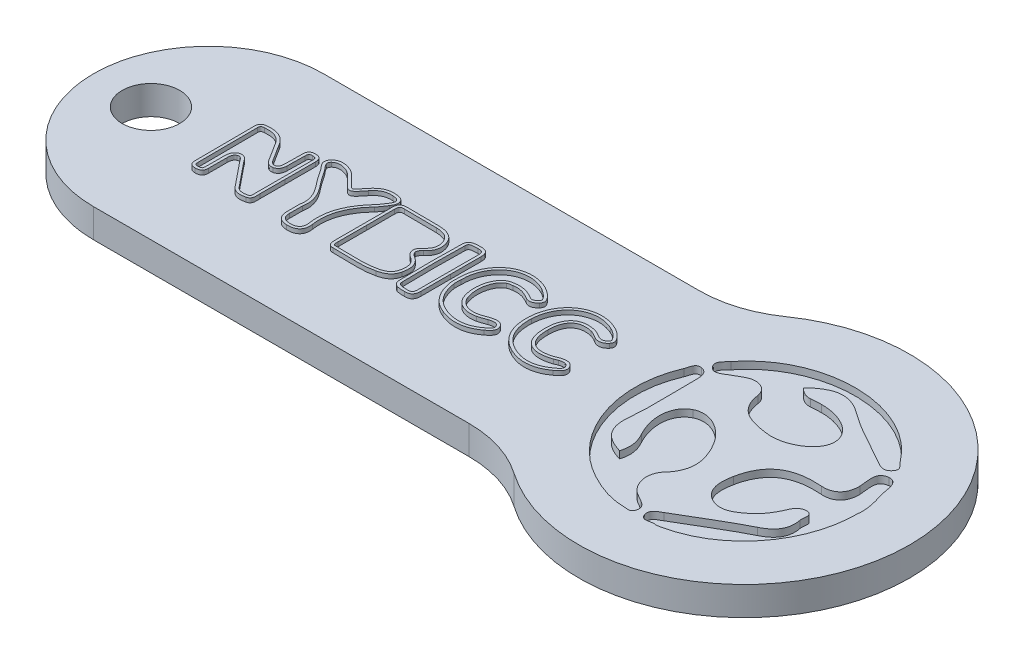
from build123d import *

# Parameters (mm, degrees)
ESQUISSE1_R             = 2
BOSS_EXTRU_1_DEPTH      = 2
BOSS_EXTRU_3_DEPTH      = 0.3
ENL_V_MAT_EXTRU_1_DEPTH = 0.5
CONG_1_R                = 8


with BuildPart() as part:
    # Esquisse1 → Boss.-Extru.1 (new body)
    with BuildSketch(Plane(origin=(0, 0, 0), x_dir=(1, 0, 0), z_dir=(0, 1, 0))):
        with BuildLine():
            Line((-18.5, 8), (18.5, 8))
            ThreePointArc((18.5, 8), (38.261355821, 0), (18.5, -8))
            Line((18.5, -8), (-18.5, -8))
            Line((-18.5, -8), (-18.5, 8))
        make_face()
        with Locations(Location((-14.5, 0, 0), (0, 0, 270))):
            Circle(ESQUISSE1_R, mode=Mode.SUBTRACT)
    extrude(amount=BOSS_EXTRU_1_DEPTH)

    # Esquisse4 → Boss.-Extru.3 (add)
    # profile 1 of 6: a face of its own
    with BuildSketch(Plane(origin=(0, 2, 0), x_dir=(1, 0, 0), z_dir=(0, 1, 0))):
        with BuildLine():
            add(Edge.make_bspline(
                [(0.224987188, -1.924556037), (0.228633477, -1.260931428), (0.227504864, -0.597480451), (0.228286212, 0.066144158)],
                knots=[10, 10, 10, 10, 11, 11, 11, 11], degree=3))
            add(Edge.make_bspline(
                [(0.228286212, 0.066144158), (0.229089264, 0.708216594), (0.242979889, 1.350658), (0.225898761, 1.992318059)],
                knots=[0, 0, 0, 0, 1, 1, 1, 1], degree=3))
            add(Edge.make_bspline(
                [(0.225898761, 1.992318059), (0.215025006, 2.398445207), (0.360594415, 2.577200187), (0.785321978, 2.564611809)],
                knots=[1, 1, 1, 1, 2, 2, 2, 2], degree=3))
            add(Edge.make_bspline(
                [(0.785321978, 2.564611809), (1.533831329, 2.542517033), (2.284445977, 2.579500822), (3.0322825, 2.547595793)],
                knots=[2, 2, 2, 2, 3, 3, 3, 3], degree=3))
            add(Edge.make_bspline(
                [(3.0322825, 2.547595793), (3.534493706, 2.526108732), (4.016064311, 2.387332707), (4.239442925, 1.857622404)],
                knots=[3, 3, 3, 3, 4, 4, 4, 4], degree=3))
            add(Edge.make_bspline(
                [(4.239442925, 1.857622404), (4.454530571, 1.347402385), (4.356862114, 0.893482805), (3.934131328, 0.525902141)],
                knots=[4, 4, 4, 4, 5, 5, 5, 5], degree=3))
            add(Edge.make_bspline(
                [(3.934131328, 0.525902141), (3.614907402, 0.248284978), (3.681842852, 0.030896697), (4.013221074, -0.175031819)],
                knots=[5, 5, 5, 5, 6, 6, 6, 6], degree=3))
            add(Edge.make_bspline(
                [(4.013221074, -0.175031819), (4.531905693, -0.497294319), (4.592156279, -0.987720197), (4.468290971, -1.524940119)],
                knots=[6, 6, 6, 6, 7, 7, 7, 7], degree=3))
            add(Edge.make_bspline(
                [(4.468290971, -1.524940119), (4.352282549, -2.028041193), (3.970333769, -2.237963263), (3.506690752, -2.346831037)],
                knots=[7, 7, 7, 7, 8, 8, 8, 8], degree=3))
            add(Edge.make_bspline(
                [(3.506690752, -2.346831037), (2.554206255, -2.570817365), (1.587874542, -2.420624982), (0.62837962, -2.452660236)],
                knots=[8, 8, 8, 8, 9, 9, 9, 9], degree=3))
            add(Edge.make_bspline(
                [(0.62837962, -2.452660236), (0.281265924, -2.464380451), (0.223381085, -2.208879767), (0.224987188, -1.924556037)],
                knots=[9, 9, 9, 9, 10, 10, 10, 10], degree=3))
        make_face()
        with BuildLine():
            add(Edge.make_bspline(
                [(0.424984085, -1.925670356), (0.428631602, -1.26182223), (0.427504457, -0.59795634), (0.428286065, 0.065901347)],
                knots=[9.999992248, 9.999992248, 9.999992248, 9.999992248, 10.999996315, 10.999996315, 10.999996315, 10.999996315], degree=3))
            add(Edge.make_bspline(
                [(0.428286065, 0.065901347), (0.429091525, 0.70981945), (0.442962706, 1.353965028), (0.425827525, 1.997655605)],
                knots=[3.823e-06, 3.823e-06, 3.823e-06, 3.823e-06, 1.000007994, 1.000007994, 1.000007994, 1.000007994], degree=3))
            add(Edge.make_bspline(
                [(0.425827525, 1.997655605), (0.423967039, 2.067143464), (0.438947198, 2.23737267), (0.48460375, 2.30148718), (0.540038492, 2.340496586), (0.650492251, 2.36361327), (0.739230905, 2.365890063), (0.779408856, 2.36469924)],
                knots=[0.99998737, 0.99998737, 0.99998737, 0.99998737, 1.249992885, 1.499998401, 1.750003917, 1.875006675, 2.000009432, 2.000009432, 2.000009432, 2.000009432], degree=3))
            add(Edge.make_bspline(
                [(0.779408856, 2.36469924), (1.527216556, 2.342625176), (2.27629181, 2.379666005), (3.023745341, 2.347778083)],
                knots=[1.999994648, 1.999994648, 1.999994648, 1.999994648, 2.99999443, 2.99999443, 2.99999443, 2.99999443], degree=3))
            add(Edge.make_bspline(
                [(3.023745341, 2.347778083), (3.136930778, 2.342935002), (3.37140751, 2.319391181), (3.663200524, 2.223176744), (3.889669009, 2.069790434), (4.013963378, 1.877595093), (4.055153922, 1.779920643)],
                knots=[3.000008495, 3.000008495, 3.000008495, 3.000008495, 3.250004337, 3.50000018, 3.749996022, 3.999991864, 3.999991864, 3.999991864, 3.999991864], degree=3))
            add(Edge.make_bspline(
                [(4.055153922, 1.779920643), (4.097872092, 1.678584518), (4.162559229, 1.450055131), (4.144429617, 1.179026601), (4.044966147, 0.92760415), (3.886121091, 0.749191021), (3.802892545, 0.676820602)],
                knots=[4.000008247, 4.000008247, 4.000008247, 4.000008247, 4.250007238, 4.50000623, 4.750005221, 5.000004213, 5.000004213, 5.000004213, 5.000004213], degree=3))
            add(Edge.make_bspline(
                [(3.802892545, 0.676820602), (3.719256651, 0.604085579), (3.559465455, 0.43459299), (3.474428323, -0.001867527), (3.739101343, -0.240157407), (3.907665226, -0.344908135)],
                knots=[4.999994422, 4.999994422, 4.999994422, 4.999994422, 5.249997715, 5.500001008, 6.000007595, 6.000007595, 6.000007595, 6.000007595], degree=3))
            add(Edge.make_bspline(
                [(3.907665226, -0.344908135), (4.003506937, -0.404455283), (4.190041839, -0.568189492), (4.30167073, -0.814276424), (4.337991762, -1.114521883), (4.300102271, -1.364212205), (4.27340411, -1.480005596)],
                knots=[5.999995147, 5.999995147, 5.999995147, 5.999995147, 6.249996361, 6.499997574, 6.749998787, 7, 7, 7, 7], degree=3))
            add(Edge.make_bspline(
                [(4.27340411, -1.480005596), (4.252204323, -1.571944058), (4.174744098, -1.760780488), (4.007148956, -1.931173829), (3.772824238, -2.065180309), (3.562394395, -2.128311717), (3.460939956, -2.152134181)],
                knots=[7, 7, 7, 7, 7.250005814, 7.500011627, 7.750017441, 8.000023255, 8.000023255, 8.000023255, 8.000023255], degree=3))
            add(Edge.make_bspline(
                [(3.460939956, -2.152134181), (3.008737569, -2.258474129), (2.088049421, -2.295926973), (1.105040506, -2.23663422), (0.621668163, -2.252772873)],
                knots=[7.999988681, 7.999988681, 7.999988681, 7.999988681, 8.500000881, 9.00001308, 9.00001308, 9.00001308, 9.00001308], degree=3))
            add(Edge.make_bspline(
                [(0.621668163, -2.252772873), (0.596954446, -2.253607326), (0.538643384, -2.249720352), (0.493824122, -2.230714574), (0.470061843, -2.210693419), (0.430793598, -2.111517716), (0.424663115, -1.982490693), (0.424984085, -1.925670356)],
                knots=[8.999963844, 8.999963844, 8.999963844, 8.999963844, 9.124970625, 9.249977406, 9.499990969, 9.750004532, 10.000018095, 10.000018095, 10.000018095, 10.000018095], degree=3))
        make_face(mode=Mode.SUBTRACT)
    # profile 2 of 6: a face of its own
    with BuildSketch(Plane(origin=(0, 2, 0), x_dir=(1, 0, 0), z_dir=(0, 1, 0))):
        with BuildLine():
            add(Edge.make_bspline(
                [(14.602153029, 1.507057756), (13.592825491, 1.74081093), (13.041367678, 1.232934953), (13.029387014, 0.077256658)],
                knots=[11, 11, 11, 11, 12, 12, 12, 12], degree=3))
            add(Edge.make_bspline(
                [(13.029387014, 0.077256658), (13.015670022, -1.229069807), (13.68320137, -1.713244904), (14.918772463, -1.291924885)],
                knots=[0, 0, 0, 0, 1, 1, 1, 1], degree=3))
            add(Edge.make_bspline(
                [(14.918772463, -1.291924885), (14.999251272, -1.2644909), (15.073566115, -1.21908592), (15.154305373, -1.192867365)],
                knots=[1, 1, 1, 1, 2, 2, 2, 2], degree=3))
            add(Edge.make_bspline(
                [(15.154305373, -1.192867365), (15.480214162, -1.086864533), (15.829563381, -1.064379084), (16.010315138, -1.39132967)],
                knots=[2, 2, 2, 2, 3, 3, 3, 3], degree=3))
            add(Edge.make_bspline(
                [(16.010315138, -1.39132967), (16.211642385, -1.755524494), (15.90327051, -1.991231037), (15.64646758, -2.177799494)],
                knots=[3, 3, 3, 3, 4, 4, 4, 4], degree=3))
            add(Edge.make_bspline(
                [(15.64646758, -2.177799494), (14.786290627, -2.80261717), (13.856313284, -2.846893537), (12.931110842, -2.370358283)],
                knots=[4, 4, 4, 4, 5, 5, 5, 5], degree=3))
            add(Edge.make_bspline(
                [(12.931110842, -2.370358283), (11.898863772, -1.838694611), (11.535276663, -0.87893924), (11.587974222, 0.202966814)],
                knots=[5, 5, 5, 5, 6, 6, 6, 6], degree=3))
            add(Edge.make_bspline(
                [(11.587974222, 0.202966814), (11.685642679, 2.205061662), (13.445584866, 3.336062394), (15.162379299, 2.559229191)],
                knots=[6, 6, 6, 6, 7, 7, 7, 7], degree=3))
            add(Edge.make_bspline(
                [(15.162379299, 2.559229191), (15.399301271, 2.45201093), (15.613390529, 2.315839397), (15.790235549, 2.126970305)],
                knots=[7, 7, 7, 7, 8, 8, 8, 8], degree=3))
            add(Edge.make_bspline(
                [(15.790235549, 2.126970305), (15.982794338, 1.921519279), (16.213986427, 1.683034612), (15.977932619, 1.407870012)],
                knots=[8, 8, 8, 8, 9, 9, 9, 9], degree=3))
            add(Edge.make_bspline(
                [(15.977932619, 1.407870012), (15.760023439, 1.153888616), (15.450522951, 1.05834716), (15.114890725, 1.26128051)],
                knots=[9, 9, 9, 9, 10, 10, 10, 10], degree=3))
            add(Edge.make_bspline(
                [(15.114890725, 1.26128051), (14.952891311, 1.359166008), (14.782731154, 1.465255656), (14.602153029, 1.507057756)],
                knots=[10, 10, 10, 10, 11, 11, 11, 11], degree=3))
        make_face()
        with BuildLine():
            add(Edge.make_bspline(
                [(14.647277304, 1.701900769), (14.518961544, 1.731617799), (14.24751126, 1.773033845), (13.775801463, 1.750191123), (13.263961439, 1.51281168), (12.967234825, 1.016162695), (12.852003034, 0.52217832), (12.830887521, 0.222987221), (12.829397899, 0.079343272)],
                knots=[11, 11, 11, 11, 11.124999543, 11.249999086, 11.499998172, 11.749997257, 11.8749968, 11.999996343, 11.999996343, 11.999996343, 11.999996343], degree=3))
            add(Edge.make_bspline(
                [(12.829397899, 0.079343272), (12.827711457, -0.081314663), (12.846405532, -0.418324142), (12.975836639, -0.960253925), (13.338197437, -1.486212684), (13.950690771, -1.666801407), (14.505586841, -1.620594531), (14.831349274, -1.533043396), (14.983321331, -1.481222121)],
                knots=[3.238e-06, 3.238e-06, 3.238e-06, 3.238e-06, 0.125002833, 0.250002429, 0.500001619, 0.75000081, 0.875000405, 1, 1, 1, 1], degree=3))
            add(Edge.make_bspline(
                [(14.983321331, -1.481222121), (15.030448158, -1.465156618), (15.135041353, -1.416959786), (15.183385484, -1.393704944), (15.216121231, -1.383074626)],
                knots=[1.000029608, 1.000029608, 1.000029608, 1.000029608, 1.500107479, 2.000185349, 2.000185349, 2.000185349, 2.000185349], degree=3))
            add(Edge.make_bspline(
                [(15.216121231, -1.383074626), (15.285599328, -1.360476662), (15.436344194, -1.321232266), (15.618676659, -1.321442848), (15.735973045, -1.358842038), (15.810778325, -1.443771165), (15.835282367, -1.488094999)],
                knots=[1.99995409, 1.99995409, 1.99995409, 1.99995409, 2.249965567, 2.499977045, 2.749988522, 3, 3, 3, 3], degree=3))
            add(Edge.make_bspline(
                [(15.835282367, -1.488094999), (15.849585268, -1.51396851), (15.874851032, -1.577349313), (15.87776428, -1.646770576), (15.849017145, -1.73553623), (15.718947451, -1.876513116), (15.590186113, -1.971479067), (15.528921091, -2.015988422)],
                knots=[3, 3, 3, 3, 3.124998928, 3.249997856, 3.499995713, 3.749993569, 3.999991426, 3.999991426, 3.999991426, 3.999991426], degree=3))
            add(Edge.make_bspline(
                [(15.528921091, -2.015988422), (15.341033035, -2.152466336), (14.91323002, -2.389704565), (14.30241614, -2.516539797), (13.678329159, -2.469179567), (13.227335323, -2.297961835), (13.022689375, -2.192556786)],
                knots=[4.000002624, 4.000002624, 4.000002624, 4.000002624, 4.250001968, 4.500001312, 4.750000656, 5, 5, 5, 5], degree=3))
            add(Edge.make_bspline(
                [(13.022689375, -2.192556786), (12.907946335, -2.133457848), (12.680511227, -1.993806633), (12.323417003, -1.683535834), (12.002278313, -1.218777723), (11.799910698, -0.566667726), (11.775714529, -0.053607783), (11.787737029, 0.193229222)],
                knots=[5, 5, 5, 5, 5.124999697, 5.249999393, 5.499998786, 5.749998179, 5.999997572, 5.999997572, 5.999997572, 5.999997572], degree=3))
            add(Edge.make_bspline(
                [(11.787737029, 0.193229222), (11.798663924, 0.417208155), (11.871393731, 0.8789254), (12.181869798, 1.633622787), (12.831472322, 2.337247754), (13.710933547, 2.633610681), (14.475241366, 2.59446994), (14.889834955, 2.463030927), (15.079929152, 2.377015105)],
                knots=[6.000001314, 6.000001314, 6.000001314, 6.000001314, 6.12500115, 6.250000985, 6.500000657, 6.750000328, 6.875000164, 7, 7, 7, 7], degree=3))
            add(Edge.make_bspline(
                [(15.079929152, 2.377015105), (15.287694017, 2.282991797), (15.488400838, 2.156711122), (15.644276602, 1.990237031)],
                knots=[7, 7, 7, 7, 8.00006262, 8.00006262, 8.00006262, 8.00006262], degree=3))
            add(Edge.make_bspline(
                [(15.644276602, 1.990237031), (15.690112081, 1.941332765), (15.789152916, 1.836841529), (15.874732297, 1.702983976), (15.880249128, 1.643624282), (15.871608614, 1.60195036), (15.841210864, 1.555665173), (15.826139308, 1.538095934)],
                knots=[7.99994246, 7.99994246, 7.99994246, 7.99994246, 8.249954771, 8.499967081, 8.749979391, 8.874985546, 8.999991701, 8.999991701, 8.999991701, 8.999991701], degree=3))
            add(Edge.make_bspline(
                [(15.826139308, 1.538095934), (15.786799745, 1.492244972), (15.689427074, 1.404830981), (15.550397416, 1.351354028), (15.409593063, 1.344339347), (15.274003479, 1.398792007), (15.218347106, 1.432443526)],
                knots=[9.000008222, 9.000008222, 9.000008222, 9.000008222, 9.250012336, 9.50001645, 9.750020564, 10.000024678, 10.000024678, 10.000024678, 10.000024678], degree=3))
            add(Edge.make_bspline(
                [(15.218347106, 1.432443526), (15.132329441, 1.484418294), (14.970539154, 1.585271168), (14.755045892, 1.676952223), (14.647277304, 1.701900769)],
                knots=[9.999948863, 9.999948863, 9.999948863, 9.999948863, 10.499967176, 10.999985489, 10.999985489, 10.999985489, 10.999985489], degree=3))
        make_face(mode=Mode.SUBTRACT)
    # profile 3 of 6: a face of its own
    with BuildSketch(Plane(origin=(0, 2, 0), x_dir=(1, 0, 0), z_dir=(0, 1, 0))):
        with BuildLine():
            add(Edge.make_bspline(
                [(-5.176035076, 0.000337322), (-5.176577678, -0.577686311), (-5.174038299, -1.155709943), (-5.179399212, -1.733733576)],
                knots=[0, 0, 0, 0, 1, 1, 1, 1], degree=3))
            add(Edge.make_bspline(
                [(-5.179399212, -1.733733576), (-5.181960296, -2.003038068), (-5.100765252, -2.340580256), (-5.46884511, -2.427223029)],
                knots=[1, 1, 1, 1, 2, 2, 2, 2], degree=3))
            add(Edge.make_bspline(
                [(-5.46884511, -2.427223029), (-5.824206365, -2.510827228), (-6.192264519, -2.520550666), (-6.463544084, -2.180664435)],
                knots=[2, 2, 2, 2, 3, 3, 3, 3], degree=3))
            add(Edge.make_bspline(
                [(-6.463544084, -2.180664435), (-6.917159807, -1.612277424), (-7.37596281, -1.0480576), (-7.83687111, -0.48566092)],
                knots=[3, 3, 3, 3, 4, 4, 4, 4], degree=3))
            add(Edge.make_bspline(
                [(-7.83687111, -0.48566092), (-7.953031462, -0.343802912), (-8.052892033, -0.118080256), (-8.285820451, -0.219047737)],
                knots=[4, 4, 4, 4, 5, 5, 5, 5], degree=3))
            add(Edge.make_bspline(
                [(-8.285820451, -0.219047737), (-8.482068937, -0.304214631), (-8.503230436, -0.51778299), (-8.503599406, -0.717026643)],
                knots=[5, 5, 5, 5, 6, 6, 6, 6], degree=3))
            add(Edge.make_bspline(
                [(-8.503599406, -0.717026643), (-8.504337346, -1.145205158), (-8.510132341, -1.573296857), (-8.50689843, -2.001388557)],
                knots=[6, 6, 6, 6, 7, 7, 7, 7], degree=3))
            add(Edge.make_bspline(
                [(-8.50689843, -2.001388557), (-8.512042114, -2.334299424), (-8.69381371, -2.444124348), (-9.002103481, -2.437008874)],
                knots=[7, 7, 7, 7, 8, 8, 8, 8], degree=3))
            add(Edge.make_bspline(
                [(-9.002103481, -2.437008874), (-9.296330826, -2.430134949), (-9.435696319, -2.290063772), (-9.429062297, -2.001388557)],
                knots=[8, 8, 8, 8, 9, 9, 9, 9], degree=3))
            add(Edge.make_bspline(
                [(-9.429062297, -2.001388557), (-9.437185031, -0.610092066), (-9.444070539, 0.781188921), (-9.450826151, 2.172535671)],
                knots=[9, 9, 9, 9, 10, 10, 10, 10], degree=3))
            add(Edge.make_bspline(
                [(-9.450826151, 2.172535671), (-9.436859715, 2.458341505), (-9.289908617, 2.578171994), (-8.999299382, 2.591438078)],
                knots=[10, 10, 10, 10, 11, 11, 11, 11], degree=3))
            add(Edge.make_bspline(
                [(-8.999299382, 2.591438078), (-8.346765568, 2.653424992), (-7.822307658, 2.477925627), (-7.472394133, 1.887704289)],
                knots=[11, 11, 11, 11, 12, 12, 12, 12], degree=3))
            add(Edge.make_bspline(
                [(-7.472394133, 1.887704289), (-7.244153801, 1.502760344), (-6.998007585, 1.128451409), (-6.756289006, 0.751624797)],
                knots=[12, 12, 12, 12, 13, 13, 13, 13], degree=3))
            add(Edge.make_bspline(
                [(-6.756289006, 0.751624797), (-6.662983074, 0.606077092), (-6.556068669, 0.448809172), (-6.356651384, 0.487399065)],
                knots=[13, 13, 13, 13, 14, 14, 14, 14], degree=3))
            add(Edge.make_bspline(
                [(-6.356651384, 0.487399065), (-6.14538366, 0.528202776), (-6.124157048, 0.736735784), (-6.114021233, 0.896043889)],
                knots=[14, 14, 14, 14, 15, 15, 15, 15], degree=3))
            add(Edge.make_bspline(
                [(-6.114021233, 0.896043889), (-6.088345281, 1.301259465), (-6.08765075, 1.70868886), (-6.093923235, 2.115033049)],
                knots=[15, 15, 15, 15, 16, 16, 16, 16], degree=3))
            add(Edge.make_bspline(
                [(-6.093923235, 2.115033049), (-6.09887177, 2.434517424), (-5.970882683, 2.59017924), (-5.639895134, 2.586749992)],
                knots=[16, 16, 16, 16, 17, 17, 17, 17], degree=3))
            add(Edge.make_bspline(
                [(-5.639895134, 2.586749992), (-5.319586004, 2.583450969), (-5.169827703, 2.441245695), (-5.172236858, 2.119721135)],
                knots=[17, 17, 17, 17, 18, 18, 18, 18], degree=3))
            add(Edge.make_bspline(
                [(-5.172236858, 2.119721135), (-5.177489251, 1.413252629), (-5.175383953, 0.706784123), (-5.176035076, 0.000337322)],
                knots=[18, 18, 18, 18, 19, 19, 19, 19], degree=3))
        make_face()
        with BuildLine():
            add(Edge.make_bspline(
                [(-5.376034988, 0.000525066), (-5.376577062, -0.576936141), (-5.374035138, -1.15441944), (-5.3793904, -1.73185607)],
                knots=[0, 0, 0, 0, 0.999986883, 0.999986883, 0.999986883, 0.999986883], degree=3))
            add(Edge.make_bspline(
                [(-5.3793904, -1.73185607), (-5.380073846, -1.803846241), (-5.369929684, -1.958205413), (-5.37853098, -2.127110698), (-5.408514886, -2.179223244), (-5.436630873, -2.20631348), (-5.491249276, -2.227029918), (-5.514660185, -2.232541291)],
                knots=[1.000026152, 1.000026152, 1.000026152, 1.000026152, 1.250016029, 1.500005907, 1.749995784, 1.874990723, 1.999985662, 1.999985662, 1.999985662, 1.999985662], degree=3))
            add(Edge.make_bspline(
                [(-5.514660185, -2.232541291), (-5.592936112, -2.250956477), (-5.758826443, -2.281362828), (-5.970152933, -2.273497018), (-6.141473193, -2.218881407), (-6.261578149, -2.113098246), (-6.307229216, -2.055902013)],
                knots=[2.000012684, 2.000012684, 2.000012684, 2.000012684, 2.250009513, 2.500006342, 2.750003171, 3, 3, 3, 3], degree=3))
            add(Edge.make_bspline(
                [(-6.307229216, -2.055902013), (-6.761350023, -1.486882123), (-7.220681947, -0.922007282), (-7.682154604, -0.3589218)],
                knots=[3, 3, 3, 3, 3.999979549, 3.999979549, 3.999979549, 3.999979549], degree=3))
            add(Edge.make_bspline(
                [(-7.682154604, -0.3589218), (-7.71063618, -0.324134566), (-7.754830347, -0.259327853), (-7.868299944, -0.11052506), (-8.07627185, 0.02715133), (-8.281446181, 0.000829684), (-8.365402033, -0.035562659)],
                knots=[4.000094353, 4.000094353, 4.000094353, 4.000094353, 4.250084711, 4.500075069, 4.750065427, 5.000055785, 5.000055785, 5.000055785, 5.000055785], degree=3))
            add(Edge.make_bspline(
                [(-8.365402033, -0.035562659), (-8.437647984, -0.06691558), (-8.573966325, -0.168565459), (-8.69890308, -0.430230356), (-8.703378074, -0.59732206), (-8.703599087, -0.716669114)],
                knots=[4.999933801, 4.999933801, 4.999933801, 4.999933801, 5.249955721, 5.499977642, 6.000021483, 6.000021483, 6.000021483, 6.000021483], degree=3))
            add(Edge.make_bspline(
                [(-8.703599087, -0.716669114), (-8.704336597, -1.144598359), (-8.710109605, -1.572536557), (-8.706911095, -2.000454484)],
                knots=[5.999990003, 5.999990003, 5.999990003, 5.999990003, 6.998108701, 6.998108701, 6.998108701, 6.998108701], degree=3))
            add(Edge.make_bspline(
                [(-8.706911095, -2.000454484), (-8.707767693, -2.046880584), (-8.729115489, -2.162370323), (-8.76231621, -2.189044406), (-8.820918397, -2.228465404), (-8.945586386, -2.238258637), (-8.997459984, -2.237062784)],
                knots=[7.00276407, 7.00276407, 7.00276407, 7.00276407, 7.25206384, 7.501363611, 7.750663382, 7.999963152, 7.999963152, 7.999963152, 7.999963152], degree=3))
            add(Edge.make_bspline(
                [(-8.997459984, -2.237062784), (-9.04191215, -2.236022618), (-9.150406873, -2.218776651), (-9.187011953, -2.184173967), (-9.217916787, -2.150809461), (-9.230026592, -2.045647027), (-9.229048881, -2.003102583)],
                knots=[8.00003983, 8.00003983, 8.00003983, 8.00003983, 8.250861529, 8.501683229, 8.752504928, 9.003326628, 9.003326628, 9.003326628, 9.003326628], degree=3))
            add(Edge.make_bspline(
                [(-9.229048881, -2.003102583), (-9.237165744, -0.61281185), (-9.244049843, 0.777485941), (-9.250800721, 2.167783978)],
                knots=[8.999309599, 8.999309599, 8.999309599, 8.999309599, 9.998628949, 9.998628949, 9.998628949, 9.998628949], degree=3))
            add(Edge.make_bspline(
                [(-9.250800721, 2.167783978), (-9.248541947, 2.207771951), (-9.228440381, 2.305108158), (-9.196900862, 2.33524068), (-9.147399772, 2.372997208), (-9.032997968, 2.389691487), (-8.985273915, 2.391870053)],
                knots=[10.007647012, 10.007647012, 10.007647012, 10.007647012, 10.257141821, 10.506636631, 10.756131441, 11.00562625, 11.00562625, 11.00562625, 11.00562625], degree=3))
            add(Edge.make_bspline(
                [(-8.985273915, 2.391870053), (-8.844340745, 2.405257884), (-8.543835863, 2.408721871), (-8.193490874, 2.315350793), (-7.898879738, 2.13598384), (-7.714536664, 1.90395931), (-7.644432912, 1.785710865)],
                knots=[10.997502953, 10.997502953, 10.997502953, 10.997502953, 11.248127215, 11.498751476, 11.749375738, 12, 12, 12, 12], degree=3))
            add(Edge.make_bspline(
                [(-7.644432912, 1.785710865), (-7.414933619, 1.39864359), (-7.167601911, 1.022417353), (-6.924646579, 0.643663099)],
                knots=[12, 12, 12, 12, 12.999979453, 12.999979453, 12.999979453, 12.999979453], degree=3))
            add(Edge.make_bspline(
                [(-6.924646579, 0.643663099), (-6.867426538, 0.554406303), (-6.79532026, 0.433607703), (-6.557867689, 0.282672798), (-6.393269124, 0.276607772), (-6.318689141, 0.291034942)],
                knots=[13.000052516, 13.000052516, 13.000052516, 13.000052516, 13.500007299, 13.749984691, 13.999962083, 13.999962083, 13.999962083, 13.999962083], degree=3))
            add(Edge.make_bspline(
                [(-6.318689141, 0.291034942), (-6.239265803, 0.306380042), (-6.078627076, 0.383432899), (-5.963338524, 0.570454256), (-5.924014307, 0.746912848), (-5.917481558, 0.835300796), (-5.914423163, 0.883370643)],
                knots=[14.000035641, 14.000035641, 14.000035641, 14.000035641, 14.250040264, 14.500044888, 14.750049511, 15.000054135, 15.000054135, 15.000054135, 15.000054135], degree=3))
            add(Edge.make_bspline(
                [(-5.914423163, 0.883370643), (-5.888392248, 1.294188213), (-5.887593641, 1.706532814), (-5.89394714, 2.118125231)],
                knots=[14.999978717, 14.999978717, 14.999978717, 14.999978717, 16.000004325, 16.000004325, 16.000004325, 16.000004325], degree=3))
            add(Edge.make_bspline(
                [(-5.89394714, 2.118125231), (-5.894738146, 2.169193679), (-5.881680811, 2.294945233), (-5.845255169, 2.337535798), (-5.814873718, 2.37068866), (-5.691332599, 2.387272184), (-5.64196104, 2.386760662)],
                knots=[15.999994499, 15.999994499, 15.999994499, 15.999994499, 16.249997414, 16.500000328, 16.750003243, 17.000006158, 17.000006158, 17.000006158, 17.000006158], degree=3))
            add(Edge.make_bspline(
                [(-5.64196104, 2.386760662), (-5.591576555, 2.386241727), (-5.468863104, 2.369296095), (-5.424159449, 2.330369281), (-5.387628326, 2.29047849), (-5.371864423, 2.170175439), (-5.372231288, 2.121213856)],
                knots=[16.999993637, 16.999993637, 16.999993637, 16.999993637, 17.249996736, 17.499999835, 17.750002934, 18.000006033, 18.000006033, 18.000006033, 18.000006033], degree=3))
            add(Edge.make_bspline(
                [(-5.372231288, 2.121213856), (-5.377486732, 1.414334856), (-5.375383452, 0.707419895), (-5.376034988, 0.000525066)],
                knots=[17.999997254, 17.999997254, 17.999997254, 17.999997254, 19, 19, 19, 19], degree=3))
        make_face(mode=Mode.SUBTRACT)
    # profile 4 of 6: a face of its own
    with BuildSketch(Plane(origin=(0, 2, 0), x_dir=(1, 0, 0), z_dir=(0, 1, 0))):
        with BuildLine():
            add(Edge.make_bspline(
                [(11.153110843, -1.367455158), (11.365724222, -1.72565965), (11.071329788, -1.969006037), (10.814266409, -2.164256135)],
                knots=[10, 10, 10, 10, 11, 11, 11, 11], degree=3))
            add(Edge.make_bspline(
                [(10.814266409, -2.164256135), (10.026320706, -2.763028888), (9.152687211, -2.818244123), (8.265510355, -2.456393342)],
                knots=[11, 11, 11, 11, 12, 12, 12, 12], degree=3))
            add(Edge.make_bspline(
                [(8.265510355, -2.456393342), (7.376488651, -2.093934846), (6.922395439, -1.369799201), (6.788329203, -0.437217365)],
                knots=[12, 12, 12, 12, 13, 13, 13, 13], degree=3))
            add(Edge.make_bspline(
                [(6.788329203, -0.437217365), (6.764150834, -0.269488069), (6.785290629, -0.095334358), (6.78550767, 0.075867595)],
                knots=[13, 13, 13, 13, 14, 14, 14, 14], degree=3))
            add(Edge.make_bspline(
                [(6.78550767, 0.075867595), (6.771248075, 2.16234799), (8.614078226, 3.420882023), (10.381312991, 2.533401311)],
                knots=[0, 0, 0, 0, 1, 1, 1, 1], degree=3))
            add(Edge.make_bspline(
                [(10.381312991, 2.533401311), (10.606167484, 2.420539982), (10.818694046, 2.259582365), (10.994670901, 2.079655363)],
                knots=[1, 1, 1, 1, 2, 2, 2, 2], degree=3))
            add(Edge.make_bspline(
                [(10.994670901, 2.079655363), (11.171602737, 1.898773381), (11.349142288, 1.656078117), (11.115866605, 1.405091887)],
                knots=[2, 2, 2, 2, 3, 3, 3, 3], degree=3))
            add(Edge.make_bspline(
                [(11.115866605, 1.405091887), (10.92079014, 1.195256633), (10.666070804, 1.062210491), (10.371415921, 1.236494426)],
                knots=[3, 3, 3, 3, 4, 4, 4, 4], degree=3))
            add(Edge.make_bspline(
                [(10.371415921, 1.236494426), (9.994372269, 1.459438957), (9.60274346, 1.610412688), (9.155031253, 1.532798821)],
                knots=[4, 4, 4, 4, 5, 5, 5, 5], degree=3))
            add(Edge.make_bspline(
                [(9.155031253, 1.532798821), (9.030189261, 1.511181535), (8.896578812, 1.499808586), (8.785714261, 1.445461516)],
                knots=[5, 5, 5, 5, 6, 6, 6, 6], degree=3))
            add(Edge.make_bspline(
                [(8.785714261, 1.445461516), (8.229481547, 1.172944817), (7.985679374, 0.128825603), (8.273063383, -0.709039533)],
                knots=[6, 6, 6, 6, 7, 7, 7, 7], degree=3))
            add(Edge.make_bspline(
                [(8.273063383, -0.709039533), (8.464406742, -1.266574494), (8.99520225, -1.533795393), (9.677839652, -1.395757307)],
                knots=[7, 7, 7, 7, 8, 8, 8, 8], degree=3))
            add(Edge.make_bspline(
                [(9.677839652, -1.395757307), (9.884636331, -1.353911799), (10.079539163, -1.255635627), (10.283123636, -1.193909162)],
                knots=[8, 8, 8, 8, 9, 9, 9, 9], degree=3))
            add(Edge.make_bspline(
                [(10.283123636, -1.193909162), (10.603736624, -1.096761604), (10.959423441, -1.04128592), (11.153110843, -1.367455158)],
                knots=[9, 9, 9, 9, 10, 10, 10, 10], degree=3))
        make_face()
        with BuildLine():
            add(Edge.make_bspline(
                [(10.981135357, -1.46955527), (10.996401667, -1.495277902), (11.024046932, -1.558475833), (11.029569315, -1.628639743), (11.004582122, -1.716686712), (10.880973283, -1.860063895), (10.753755902, -1.959066805), (10.693277168, -2.005002865)],
                knots=[10.000022808, 10.000022808, 10.000022808, 10.000022808, 10.12502303, 10.250023253, 10.500023698, 10.750024144, 11.000024589, 11.000024589, 11.000024589, 11.000024589], degree=3))
            add(Edge.make_bspline(
                [(10.693277168, -2.005002865), (10.521694083, -2.135391641), (10.130372001, -2.362306967), (9.560674934, -2.497058115), (8.968380433, -2.478942989), (8.539904111, -2.35231376), (8.341029907, -2.271199396)],
                knots=[10.999991979, 10.999991979, 10.999991979, 10.999991979, 11.249995199, 11.499998418, 11.750001637, 12.000004856, 12.000004856, 12.000004856, 12.000004856], degree=3))
            add(Edge.make_bspline(
                [(8.341029907, -2.271199396), (8.149240212, -2.1930058), (7.771589461, -1.977136753), (7.388317438, -1.56199535), (7.119208663, -1.047659722), (7.016447092, -0.618506688), (6.986288575, -0.408720196)],
                knots=[11.999995153, 11.999995153, 11.999995153, 11.999995153, 12.24999977, 12.500004387, 12.750009005, 13.000013622, 13.000013622, 13.000013622, 13.000013622], degree=3))
            add(Edge.make_bspline(
                [(6.986288575, -0.408720196), (6.975733104, -0.335495169), (6.974852688, -0.200431961), (6.985397194, -0.01140238), (6.985508536, 0.076424242)],
                knots=[12.999924268, 12.999924268, 12.999924268, 12.999924268, 13.500750867, 14.001577467, 14.001577467, 14.001577467, 14.001577467], degree=3))
            add(Edge.make_bspline(
                [(6.985508536, 0.076424242), (6.983914707, 0.309635233), (7.034946111, 0.793610232), (7.324565839, 1.590815539), (7.977623489, 2.342110293), (8.882294004, 2.65573146), (9.668343442, 2.604044777), (10.097443809, 2.452153796), (10.291576077, 2.354663271)],
                knots=[-0.000129433, -0.000129433, -0.000129433, -0.000129433, 0.124887176, 0.249903786, 0.499937004, 0.749970222, 0.874986832, 1.000003441, 1.000003441, 1.000003441, 1.000003441], degree=3))
            add(Edge.make_bspline(
                [(10.291576077, 2.354663271), (10.499226445, 2.250437218), (10.689237314, 2.1059102), (10.85169287, 1.939808009)],
                knots=[0.999972954, 0.999972954, 0.999972954, 0.999972954, 2.000007846, 2.000007846, 2.000007846, 2.000007846], degree=3))
            add(Edge.make_bspline(
                [(10.85169287, 1.939808009), (10.889985794, 1.900660164), (10.969137688, 1.812768881), (11.028703427, 1.698206901), (11.029456882, 1.645367003), (11.015931351, 1.600478693), (10.984715537, 1.557760497), (10.969378946, 1.541258572)],
                knots=[1.999992196, 1.999992196, 1.999992196, 1.999992196, 2.249989925, 2.499987653, 2.749985382, 2.874984246, 2.99998311, 2.99998311, 2.99998311, 2.99998311], degree=3))
            add(Edge.make_bspline(
                [(10.969378946, 1.541258572), (10.931201372, 1.500193607), (10.841792861, 1.418569305), (10.719451011, 1.361092061), (10.619445485, 1.346331037), (10.515054297, 1.383900961), (10.473223223, 1.408643413)],
                knots=[3.000017914, 3.000017914, 3.000017914, 3.000017914, 3.250016837, 3.500015761, 3.750014684, 4.000013608, 4.000013608, 4.000013608, 4.000013608], degree=3))
            add(Edge.make_bspline(
                [(10.473223223, 1.408643413), (10.275277191, 1.525688177), (9.869771299, 1.731700545), (9.358527136, 1.771056117), (9.120889635, 1.729863151)],
                knots=[3.999989365, 3.999989365, 3.999989365, 3.999989365, 4.499988089, 4.999986814, 4.999986814, 4.999986814, 4.999986814], degree=3))
            add(Edge.make_bspline(
                [(9.120889635, 1.729863151), (9.056208433, 1.718663785), (8.940325592, 1.705842549), (8.769579654, 1.66028725), (8.697701267, 1.625054704)],
                knots=[5.000053119, 5.000053119, 5.000053119, 5.000053119, 5.500004752, 5.999956385, 5.999956385, 5.999956385, 5.999956385], degree=3))
            add(Edge.make_bspline(
                [(8.697701267, 1.625054704), (8.336123575, 1.447894907), (8.013192277, 0.873985111), (7.921160776, -0.060598879), (8.005973205, -0.546784869), (8.083888025, -0.773944729)],
                knots=[6.000009146, 6.000009146, 6.000009146, 6.000009146, 6.500007935, 6.75000733, 7.000006724, 7.000006724, 7.000006724, 7.000006724], degree=3))
            add(Edge.make_bspline(
                [(8.083888025, -0.773944729), (8.137047597, -0.928840723), (8.303297874, -1.227783062), (8.687712454, -1.518788246), (9.162643203, -1.65285935), (9.540931905, -1.627489858), (9.717492906, -1.591786946)],
                knots=[6.999989895, 6.999989895, 6.999989895, 6.999989895, 7.249994009, 7.499998122, 7.750002235, 8.000006348, 8.000006348, 8.000006348, 8.000006348], degree=3))
            add(Edge.make_bspline(
                [(9.717492906, -1.591786946), (9.831740815, -1.568668772), (10.066409103, -1.487254705), (10.243065434, -1.41504673), (10.341137917, -1.385310164)],
                knots=[7.999979044, 7.999979044, 7.999979044, 7.999979044, 8.499974202, 8.999969361, 8.999969361, 8.999969361, 8.999969361], degree=3))
            add(Edge.make_bspline(
                [(10.341137917, -1.385310164), (10.413173891, -1.363483299), (10.566973748, -1.322453676), (10.758308749, -1.314448279), (10.879000382, -1.345852846), (10.955630145, -1.426608917), (10.981135357, -1.46955527)],
                knots=[9.000018922, 9.000018922, 9.000018922, 9.000018922, 9.250007842, 9.499996762, 9.749985682, 9.999974602, 9.999974602, 9.999974602, 9.999974602], degree=3))
        make_face(mode=Mode.SUBTRACT)
    # profile 5 of 6: a face of its own
    with BuildSketch(Plane(origin=(0, 2, 0), x_dir=(1, 0, 0), z_dir=(0, 1, 0))):
        with BuildLine():
            add(Edge.make_bspline(
                [(6.295667802, 2.165603606), (6.288896122, 1.461392326), (6.292281962, 0.757094231), (6.291652543, 0.052861248)],
                knots=[6, 6, 6, 6, 7, 7, 7, 7], degree=3))
            add(Edge.make_bspline(
                [(6.291652543, 0.052861248), (6.291109941, -0.630036604), (6.28883101, -1.313021272), (6.289894511, -1.995919123)],
                knots=[0, 0, 0, 0, 1, 1, 1, 1], degree=3))
            add(Edge.make_bspline(
                [(6.289894511, -1.995919123), (6.29052393, -2.36896922), (6.171889311, -2.60476258), (5.736548442, -2.599119513)],
                knots=[1, 1, 1, 1, 2, 2, 2, 2], degree=3))
            add(Edge.make_bspline(
                [(5.736548442, -2.599119513), (5.332526591, -2.593823713), (4.886789458, -2.605978009), (4.874591753, -2.082561896)],
                knots=[2, 2, 2, 2, 3, 3, 3, 3], degree=3))
            add(Edge.make_bspline(
                [(4.874591753, -2.082561896), (4.840841875, -0.632814729), (4.839561333, 0.818820696), (4.877825664, 2.268437639)],
                knots=[3, 3, 3, 3, 4, 4, 4, 4], degree=3))
            add(Edge.make_bspline(
                [(4.877825664, 2.268437639), (4.890761308, 2.75808217), (5.342445366, 2.733990617), (5.71134998, 2.74358383)],
                knots=[4, 4, 4, 4, 5, 5, 5, 5], degree=3))
            add(Edge.make_bspline(
                [(5.71134998, 2.74358383), (6.112572001, 2.753958391), (6.29946602, 2.567172893), (6.295667802, 2.165603606)],
                knots=[5, 5, 5, 5, 6, 6, 6, 6], degree=3))
        make_face()
        with BuildLine():
            add(Edge.make_bspline(
                [(6.09567689, 2.167510284), (6.088899751, 1.462714855), (6.092282565, 0.75785781), (6.091652614, 0.05303008)],
                knots=[6.000007755, 6.000007755, 6.000007755, 6.000007755, 7.000004696, 7.000004696, 7.000004696, 7.000004696], degree=3))
            add(Edge.make_bspline(
                [(6.091652614, 0.05303008), (6.091109858, -0.630061175), (6.088830973, -1.313152936), (6.089894774, -1.996243578)],
                knots=[-4.842e-06, -4.842e-06, -4.842e-06, -4.842e-06, 1.00000634, 1.00000634, 1.00000634, 1.00000634], degree=3))
            add(Edge.make_bspline(
                [(6.089894774, -1.996243578), (6.090010874, -2.065054905), (6.075498448, -2.226116286), (6.023264096, -2.321554224), (5.966468835, -2.365802496), (5.865206056, -2.394613015), (5.778204746, -2.399642137), (5.739154518, -2.399136493)],
                knots=[0.999988394, 0.999988394, 0.999988394, 0.999988394, 1.249988122, 1.499987849, 1.749987577, 1.874987441, 1.999987305, 1.999987305, 1.999987305, 1.999987305], degree=3))
            add(Edge.make_bspline(
                [(5.739154518, -2.399136493), (5.642345835, -2.397867659), (5.43465725, -2.397746328), (5.208191329, -2.353460515), (5.131549712, -2.29192451), (5.088997952, -2.214242478), (5.075495285, -2.119003298), (5.074537467, -2.077902355)],
                knots=[2.000012392, 2.000012392, 2.000012392, 2.000012392, 2.250009294, 2.500006196, 2.750003098, 2.875001549, 3, 3, 3, 3], degree=3))
            add(Edge.make_bspline(
                [(5.074537467, -2.077902355), (5.040860247, -0.631276263), (5.039573466, 0.816641217), (5.077756024, 2.263160244)],
                knots=[3, 3, 3, 3, 4, 4, 4, 4], degree=3))
            add(Edge.make_bspline(
                [(5.077756024, 2.263160244), (5.078705409, 2.299096697), (5.091930228, 2.383236839), (5.129159871, 2.444769875), (5.204834649, 2.502397951), (5.430594114, 2.541043349), (5.624848124, 2.541267013), (5.716533678, 2.543651018)],
                knots=[4, 4, 4, 4, 4.124998313, 4.249996626, 4.499993251, 4.749989877, 4.999986503, 4.999986503, 4.999986503, 4.999986503], degree=3))
            add(Edge.make_bspline(
                [(5.716533678, 2.543651018), (5.782902798, 2.545366278), (5.941705571, 2.527953255), (6.017273188, 2.470140773), (6.076590053, 2.39383879), (6.096308471, 2.234383131), (6.09567689, 2.167510284)],
                knots=[5.000013769, 5.000013769, 5.000013769, 5.000013769, 5.25000662, 5.499999471, 5.749992323, 5.999985174, 5.999985174, 5.999985174, 5.999985174], degree=3))
        make_face(mode=Mode.SUBTRACT)
    # profile 6 of 6: a face of its own
    with BuildSketch(Plane(origin=(0, 2, 0), x_dir=(1, 0, 0), z_dir=(0, 1, 0))):
        with BuildLine():
            add(Edge.make_bspline(
                [(-0.402626163, 1.453321399), (-0.608240609, 1.229475899), (-0.996518068, 0.738250229), (-1.378387335, -0.023714173), (-1.574428713, -0.837472537), (-1.555539459, -1.467470869), (-1.510570951, -1.766685959)],
                knots=[9.000001513, 9.000001513, 9.000001513, 9.000001513, 9.250000809, 9.500000105, 9.7499994, 9.999998696, 9.999998696, 9.999998696, 9.999998696], degree=3))
            add(Edge.make_bspline(
                [(-1.510570951, -1.766685959), (-1.491096461, -1.896222451), (-1.486166018, -2.175201614), (-1.669680949, -2.500016564), (-1.992176086, -2.665715286), (-2.261334766, -2.683724153), (-2.389883886, -2.679097614)],
                knots=[10.000003214, 10.000003214, 10.000003214, 10.000003214, 10.249997923, 10.499992631, 10.749987339, 10.999982048, 10.999982048, 10.999982048, 10.999982048], degree=3))
            add(Edge.make_bspline(
                [(-2.389883886, -2.679097614), (-2.59633465, -2.671722328), (-3.058772933, -2.546283384), (-3.170344879, -2.091168043), (-3.17154604, -1.887877299)],
                knots=[11.00002167, 11.00002167, 11.00002167, 11.00002167, 11.500014465, 12.000007261, 12.000007261, 12.000007261, 12.000007261], degree=3))
            add(Edge.make_bspline(
                [(-3.17154604, -1.887877299), (-3.172345325, -1.750631998), (-3.172157101, -1.557707416), (-3.171230179, -1.248680597), (-3.170832354, -1.05582418), (-3.170718969, -0.9641887)],
                knots=[11.999989006, 11.999989006, 11.999989006, 11.999989006, 12.509525755, 12.764294129, 13.019062504, 13.019062504, 13.019062504, 13.019062504], degree=3))
            add(Edge.make_bspline(
                [(-3.170718969, -0.9641887), (-3.107545123, -0.68304835), (-3.147827178, -0.245812532), (-3.439979017, 0.32964015), (-3.656571147, 0.62780832), (-3.76870337, 0.765928145)],
                knots=[-0.01093393, -0.01093393, -0.01093393, -0.01093393, 0.494527013, 0.747257484, 0.999987955, 0.999987955, 0.999987955, 0.999987955], degree=3))
            add(Edge.make_bspline(
                [(-3.76870337, 0.765928145), (-4.02944568, 1.08692259), (-4.26217942, 1.43044559), (-4.486160686, 1.778089628)],
                knots=[1.000021828, 1.000021828, 1.000021828, 1.000021828, 2.000008511, 2.000008511, 2.000008511, 2.000008511], degree=3))
            add(Edge.make_bspline(
                [(-4.486160686, 1.778089628), (-4.5224379, 1.834408754), (-4.602314223, 1.921391153), (-4.784127503, 2.129132754), (-4.939626594, 2.418981585), (-4.826843294, 2.695313788), (-4.739285731, 2.784112495)],
                knots=[1.999987641, 1.999987641, 1.999987641, 1.999987641, 2.249987091, 2.499986541, 2.749985991, 2.999985441, 2.999985441, 2.999985441, 2.999985441], degree=3))
            add(Edge.make_bspline(
                [(-4.739285731, 2.784112495), (-4.656603453, 2.867994514), (-4.439088503, 2.994404726), (-3.989560254, 3.032254326), (-3.672797288, 2.93449946), (-3.479693961, 2.838163682)],
                knots=[3.000015492, 3.000015492, 3.000015492, 3.000015492, 3.250011619, 3.500007746, 4, 4, 4, 4], degree=3))
            add(Edge.make_bspline(
                [(-3.479693961, 2.838163682), (-3.349390097, 2.773152633), (-3.109058999, 2.579751657), (-2.940569271, 2.388804959), (-2.848975965, 2.291471941)],
                knots=[4, 4, 4, 4, 4.499994609, 4.999989217, 4.999989217, 4.999989217, 4.999989217], degree=3))
            add(Edge.make_bspline(
                [(-2.848975965, 2.291471941), (-2.770537563, 2.208131877), (-2.596825398, 2.023793863), (-2.428553433, 1.86148542), (-2.306217487, 1.781503445), (-2.280074864, 1.782221453), (-2.25463919, 1.78305258), (-2.137850675, 1.871973283), (-1.980562975, 2.049013691), (-1.818836083, 2.252021727), (-1.746223574, 2.343814544)],
                knots=[5.000002585, 5.000002585, 5.000002585, 5.000002585, 5.125002262, 5.250001938, 5.375001615, 5.500001292, 5.625000969, 5.750000646, 5.875000323, 6, 6, 6, 6], degree=3))
            add(Edge.make_bspline(
                [(-1.746223574, 2.343814544), (-1.591797707, 2.539034405), (-1.299573047, 2.808549026), (-0.838155188, 2.958544958), (-0.563716232, 2.970265641), (-0.432124592, 2.961936769)],
                knots=[6, 6, 6, 6, 6.5, 6.75, 7, 7, 7, 7], degree=3))
            add(Edge.make_bspline(
                [(-0.432124592, 2.961936769), (-0.311132983, 2.954276959), (-0.058707501, 2.924145867), (0.221658579, 2.690092792), (0.207033273, 2.338256498), (0.09193094, 2.142565033), (0.030946038, 2.049417845)],
                knots=[7, 7, 7, 7, 7.249998341, 7.499996682, 7.749995023, 7.999993364, 7.999993364, 7.999993364, 7.999993364], degree=3))
            add(Edge.make_bspline(
                [(0.030946038, 2.049417845), (-0.103619431, 1.843844111), (-0.23640473, 1.634260229), (-0.402626163, 1.453321399)],
                knots=[8.000013315, 8.000013315, 8.000013315, 8.000013315, 8.999992077, 8.999992077, 8.999992077, 8.999992077], degree=3))
        make_face()
        with BuildLine():
            add(Edge.make_bspline(
                [(-2.994620941, 2.154404289), (-2.27463078, 1.389421526), (-2.259850287, 1.372145061), (-1.589367181, 2.219733635)],
                knots=[5, 5, 5, 5, 6, 6, 6, 6], degree=3))
            add(Edge.make_bspline(
                [(-1.589367181, 2.219733635), (-1.281017011, 2.609539299), (-0.947468378, 2.794154387), (-0.444757978, 2.762336174)],
                knots=[6, 6, 6, 6, 7, 7, 7, 7], degree=3))
            add(Edge.make_bspline(
                [(-0.444757978, 2.762336174), (0.058516729, 2.730474553), (0.108284234, 2.532663371), (-0.136386103, 2.15896215)],
                knots=[7, 7, 7, 7, 8, 8, 8, 8], degree=3))
            add(Edge.make_bspline(
                [(-0.136386103, 2.15896215), (-0.2649612, 1.962540031), (-0.392038715, 1.760474846), (-0.54991435, 1.58862177)],
                knots=[8, 8, 8, 8, 9, 9, 9, 9], degree=3))
            add(Edge.make_bspline(
                [(-0.54991435, 1.58862177), (-1.432381415, 0.627911418), (-1.908916669, -0.461873225), (-1.708349066, -1.796415021)],
                knots=[9, 9, 9, 9, 10, 10, 10, 10], degree=3))
            add(Edge.make_bspline(
                [(-1.708349066, -1.796415021), (-1.634251263, -2.28927176), (-1.886018841, -2.497110236), (-2.382717206, -2.479226056)],
                knots=[10, 10, 10, 10, 11, 11, 11, 11], degree=3))
            add(Edge.make_bspline(
                [(-2.382717206, -2.479226056), (-2.788779242, -2.464727717), (-2.969248846, -2.276075666), (-2.971549481, -1.886704084)],
                knots=[11, 11, 11, 11, 12, 12, 12, 12], degree=3))
            add(Edge.make_bspline(
                [(-2.971549481, -1.886704084), (-2.973047064, -1.629553889), (-2.971223919, -1.372403693), (-2.970746429, -0.986504768)],
                knots=[12, 12, 12, 12, 13, 13, 13, 13], degree=3))
            add(Edge.make_bspline(
                [(-2.970746429, -0.986504768), (-2.823245355, -0.33008592), (-3.134872845, 0.302523528), (-3.613448284, 0.892006926)],
                knots=[0, 0, 0, 0, 1, 1, 1, 1], degree=3))
            add(Edge.make_bspline(
                [(-3.613448284, 0.892006926), (-3.869122601, 1.206759807), (-4.098122576, 1.545083342), (-4.318028533, 1.886402043)],
                knots=[1, 1, 1, 1, 2, 2, 2, 2], degree=3))
            add(Edge.make_bspline(
                [(-4.318028533, 1.886402043), (-4.469436346, 2.121457463), (-4.860023357, 2.376827922), (-4.596861126, 2.643701555)],
                knots=[2, 2, 2, 2, 3, 3, 3, 3], degree=3))
            add(Edge.make_bspline(
                [(-4.596861126, 2.643701555), (-4.345202068, 2.899028605), (-3.899009149, 2.823845598), (-3.56897658, 2.659198283)],
                knots=[3, 3, 3, 3, 4, 4, 4, 4], degree=3))
            add(Edge.make_bspline(
                [(-3.56897658, 2.659198283), (-3.348159051, 2.549028264), (-3.169534295, 2.340278215), (-2.994620941, 2.154404289)],
                knots=[4, 4, 4, 4, 5, 5, 5, 5], degree=3))
        make_face(mode=Mode.SUBTRACT)
    extrude(amount=BOSS_EXTRU_3_DEPTH)

    # Esquisse5 → Enlèv. mat.-Extru.1 (cut)
    with BuildSketch(Plane(origin=(0, 2, 0), x_dir=(1, 0, 0), z_dir=(0, 1, 0))):
        with BuildLine():
            add(Edge.make_bspline(
                [(23.186663146, -6.769797032), (19.809617805, -4.933230685), (18.300149632, -0.679304914), (19.787679299, 2.792463637)],
                knots=[9, 9, 9, 9, 10, 10, 10, 10], degree=3))
            add(Edge.make_bspline(
                [(19.787679299, 2.792463637), (19.903969875, 3.063808315), (19.90182551, 3.526413876), (20.358905207, 3.437257768)],
                knots=[10, 10, 10, 10, 11, 11, 11, 11], degree=3))
            add(Edge.make_bspline(
                [(20.358905207, 3.437257768), (20.775736818, 3.356019316), (20.87586218, 3.003106284), (20.870748693, 2.587676757)],
                knots=[11, 11, 11, 11, 12, 12, 12, 12], degree=3))
            add(Edge.make_bspline(
                [(20.870748693, 2.587676757), (20.851779309, 1.040022388), (20.974997834, -0.519467229), (20.824727316, -2.052853322)],
                knots=[12, 12, 12, 12, 13, 13, 13, 13], degree=3))
            add(Edge.make_bspline(
                [(20.824727316, -2.052853322), (20.689962209, -3.427226486), (21.291704084, -4.053216183), (22.495847638, -4.410995275)],
                knots=[13, 13, 13, 13, 14, 14, 14, 14], degree=3))
            add(Edge.make_bspline(
                [(22.495847638, -4.410995275), (22.689500314, -3.765376388), (22.587395539, -3.237532638), (22.270524338, -2.661688097)],
                knots=[0, 0, 0, 0, 1, 1, 1, 1], degree=3))
            add(Edge.make_bspline(
                [(22.270524338, -2.661688097), (21.485191808, -1.2333759), (21.653277053, 0.156172771), (22.576508761, 0.620386606)],
                knots=[1, 1, 1, 1, 2, 2, 2, 2], degree=3))
            add(Edge.make_bspline(
                [(22.576508761, 0.620386606), (23.507658126, 1.088518032), (24.876752853, 0.314154756), (25.561795069, -1.087229162)],
                knots=[2, 2, 2, 2, 3, 3, 3, 3], degree=3))
            add(Edge.make_bspline(
                [(25.561795069, -1.087229162), (26.074133409, -2.134999006), (26.251950772, -3.132623693), (25.35082252, -4.130743234)],
                knots=[3, 3, 3, 3, 4, 4, 4, 4], degree=3))
            add(Edge.make_bspline(
                [(25.35082252, -4.130743234), (24.736379405, -4.811166818), (24.985950528, -5.909246768), (25.740107286, -6.388759825)],
                knots=[4, 4, 4, 4, 5, 5, 5, 5], degree=3))
            add(Edge.make_bspline(
                [(25.740107286, -6.388759825), (25.911656505, -6.49779255), (26.091783184, -6.593464229), (26.267951036, -6.695239102)],
                knots=[5, 5, 5, 5, 6, 6, 6, 6], degree=3))
            add(Edge.make_bspline(
                [(26.267951036, -6.695239102), (26.529893497, -6.846664278), (26.743505264, -7.040811807), (26.661194629, -7.375167833)],
                knots=[6, 6, 6, 6, 7, 7, 7, 7], degree=3))
            add(Edge.make_bspline(
                [(26.661194629, -7.375167833), (26.55991461, -7.786391104), (26.214012003, -7.63529583), (25.956688175, -7.628862735)],
                knots=[7, 7, 7, 7, 8, 8, 8, 8], degree=3))
            add(Edge.make_bspline(
                [(25.956688175, -7.628862735), (24.954939708, -7.603295303), (24.048368068, -7.23825836), (23.186663146, -6.769797032)],
                knots=[8, 8, 8, 8, 9, 9, 9, 9], degree=3))
        make_face()
        with BuildLine():
            add(Edge.make_bspline(
                [(29.456952041, 3.520475634), (29.409446103, 2.504623842), (27.919937022, 1.549803984), (26.503501309, 1.757642461)],
                knots=[3, 3, 3, 3, 4, 4, 4, 4], degree=3))
            add(Edge.make_bspline(
                [(26.503501309, 1.757642461), (25.335811964, 1.929109204), (24.195669464, 2.169525537), (23.97545965, 3.74307724)],
                knots=[4, 4, 4, 4, 5, 5, 5, 5], degree=3))
            add(Edge.make_bspline(
                [(23.97545965, 3.74307724), (23.890674747, 4.347953188), (23.203983019, 4.748619584), (22.453125285, 4.37294329)],
                knots=[5, 5, 5, 5, 6, 6, 6, 6], degree=3))
            add(Edge.make_bspline(
                [(22.453125285, 4.37294329), (22.198935529, 4.245848412), (21.95414799, 4.098959394), (21.711174914, 3.950998192)],
                knots=[6, 6, 6, 6, 7, 7, 7, 7], degree=3))
            add(Edge.make_bspline(
                [(21.711174914, 3.950998192), (21.36015882, 3.737303949), (20.97582259, 3.449629106), (20.651198684, 3.911574862)],
                knots=[7, 7, 7, 7, 8, 8, 8, 8], degree=3))
            add(Edge.make_bspline(
                [(20.651198684, 3.911574862), (20.37061674, 4.311086601), (20.809056955, 4.578389975), (21.005183898, 4.828868329)],
                knots=[8, 8, 8, 8, 9, 9, 9, 9], degree=3))
            add(Edge.make_bspline(
                [(21.005183898, 4.828868329), (23.928283614, 8.56352781), (30.092343955, 8.488392552), (32.918122479, 4.687917553)],
                knots=[9, 9, 9, 9, 10, 10, 10, 10], degree=3))
            add(Edge.make_bspline(
                [(32.918122479, 4.687917553), (33.085218016, 4.463171581), (33.509967284, 4.24906496), (33.194745595, 3.874873227)],
                knots=[10, 10, 10, 10, 11, 11, 11, 11], degree=3))
            add(Edge.make_bspline(
                [(33.194745595, 3.874873227), (32.899647948, 3.524434462), (32.5761787, 3.664642958), (32.22565746, 3.874130946)],
                knots=[11, 11, 11, 11, 12, 12, 12, 12], degree=3))
            add(Edge.make_bspline(
                [(32.22565746, 3.874130946), (30.969719238, 4.624658778), (29.615800019, 5.237122479), (28.44893543, 6.103610985)],
                knots=[12, 12, 12, 12, 13, 13, 13, 13], degree=3))
            add(Edge.make_bspline(
                [(28.44893543, 6.103610985), (27.188048672, 7.040038787), (26.193393106, 6.833107542), (25.100591593, 5.772636459)],
                knots=[13, 13, 13, 13, 14, 14, 14, 14], degree=3))
            add(Edge.make_bspline(
                [(25.100591593, 5.772636459), (25.3971738, 5.479930604), (25.666374112, 5.331886927), (26.013596329, 5.360258529)],
                knots=[0, 0, 0, 0, 1, 1, 1, 1], degree=3))
            add(Edge.make_bspline(
                [(26.013596329, 5.360258529), (26.256899307, 5.380217621), (26.50086209, 5.404218016), (26.744494971, 5.402403553)],
                knots=[1, 1, 1, 1, 2, 2, 2, 2], degree=3))
            add(Edge.make_bspline(
                [(26.744494971, 5.402403553), (28.303283545, 5.391021923), (29.505447685, 4.55381225), (29.456952041, 3.520475634)],
                knots=[2, 2, 2, 2, 3, 3, 3, 3], degree=3))
        make_face()
        with BuildLine():
            add(Edge.make_bspline(
                [(28.008680752, -2.001388557), (28.386418936, -0.107419202), (29.587098515, 0.635397163), (31.650307773, 0.477786318)],
                knots=[11, 11, 11, 11, 12, 12, 12, 12], degree=3))
            add(Edge.make_bspline(
                [(31.650307773, 0.477786318), (32.417990526, 0.419063701), (33.010660087, 0.836142739), (32.989876239, 1.811746445)],
                knots=[12, 12, 12, 12, 13, 13, 13, 13], degree=3))
            add(Edge.make_bspline(
                [(32.989876239, 1.811746445), (32.978164706, 2.360538994), (32.650406728, 3.276925229), (33.476812098, 3.344967587)],
                knots=[13, 13, 13, 13, 14, 14, 14, 14], degree=3))
            add(Edge.make_bspline(
                [(33.476812098, 3.344967587), (34.182473212, 3.403277826), (34.110719452, 2.450684809), (34.290846131, 1.919624511)],
                knots=[14, 14, 14, 14, 15, 15, 15, 15], degree=3))
            add(Edge.make_bspline(
                [(34.290846131, 1.919624511), (34.511550799, 1.269222041), (34.657202684, 0.583272593), (34.572252831, 0.043016267)],
                knots=[15, 15, 15, 15, 16, 16, 16, 16], degree=3))
            add(Edge.make_bspline(
                [(34.572252831, 0.043016267), (34.557242274, -3.684715265), (31.980540019, -6.861509883), (28.528111992, -7.568985459)],
                knots=[0, 0, 0, 0, 1, 1, 1, 1], degree=3))
            add(Edge.make_bspline(
                [(28.528111992, -7.568985459), (28.409347149, -7.593233282), (28.279365625, -7.630677198), (28.166703975, -7.606264424)],
                knots=[1, 1, 1, 1, 2, 2, 2, 2], degree=3))
            add(Edge.make_bspline(
                [(28.166703975, -7.606264424), (27.847688408, -7.537479786), (27.395062393, -7.903011582), (27.221038907, -7.385394805)],
                knots=[2, 2, 2, 2, 3, 3, 3, 3], degree=3))
            add(Edge.make_bspline(
                [(27.221038907, -7.385394805), (27.065984805, -6.923366573), (27.456754131, -6.765673253), (27.778408916, -6.581257842)],
                knots=[3, 3, 3, 3, 4, 4, 4, 4], degree=3))
            add(Edge.make_bspline(
                [(27.778408916, -6.581257842), (29.151792373, -5.793780948), (30.49004123, -4.937849317), (31.901363456, -4.226579865)],
                knots=[4, 4, 4, 4, 5, 5, 5, 5], degree=3))
            add(Edge.make_bspline(
                [(31.901363456, -4.226579865), (32.758779647, -3.794737697), (33.131239393, -3.238522345), (32.960349979, -2.315290637)],
                knots=[5, 5, 5, 5, 6, 6, 6, 6], degree=3))
            add(Edge.make_bspline(
                [(32.960349979, -2.315290637), (32.90839036, -2.033883937), (33.154827411, -1.581257922), (32.667231747, -1.528308596)],
                knots=[6, 6, 6, 6, 7, 7, 7, 7], degree=3))
            add(Edge.make_bspline(
                [(32.667231747, -1.528308596), (32.350195595, -1.493998752), (32.043386415, -1.733177951), (31.914889452, -2.047739836)],
                knots=[7, 7, 7, 7, 8, 8, 8, 8], degree=3))
            add(Edge.make_bspline(
                [(31.914889452, -2.047739836), (31.664328622, -2.660368488), (31.338550058, -3.217903449), (30.828521035, -3.640178449)],
                knots=[8, 8, 8, 8, 9, 9, 9, 9], degree=3))
            add(Edge.make_bspline(
                [(30.828521035, -3.640178449), (30.215067627, -4.148228058), (29.523757265, -4.58204964), (28.723249229, -4.145918742)],
                knots=[9, 9, 9, 9, 10, 10, 10, 10], degree=3))
            add(Edge.make_bspline(
                [(28.723249229, -4.145918742), (27.87045167, -3.681416242), (27.841750166, -2.838515754), (28.008680752, -2.001388557)],
                knots=[10, 10, 10, 10, 11, 11, 11, 11], degree=3))
        make_face()
    extrude(amount=-ENL_V_MAT_EXTRU_1_DEPTH, mode=Mode.SUBTRACT)

    # Congé1
    cong_1_edges = [part.edges().sort_by_distance(p)[0] for p in [
        (18.5, 1, -8),
        (-18.5, 1, -8),
        (18.5, 1, 8),
        (-18.5, 1, 8),
    ]]
    fillet(cong_1_edges, radius=CONG_1_R - 0.0001)  # a hair under: the kernel refuses the full size


solid = part.part
